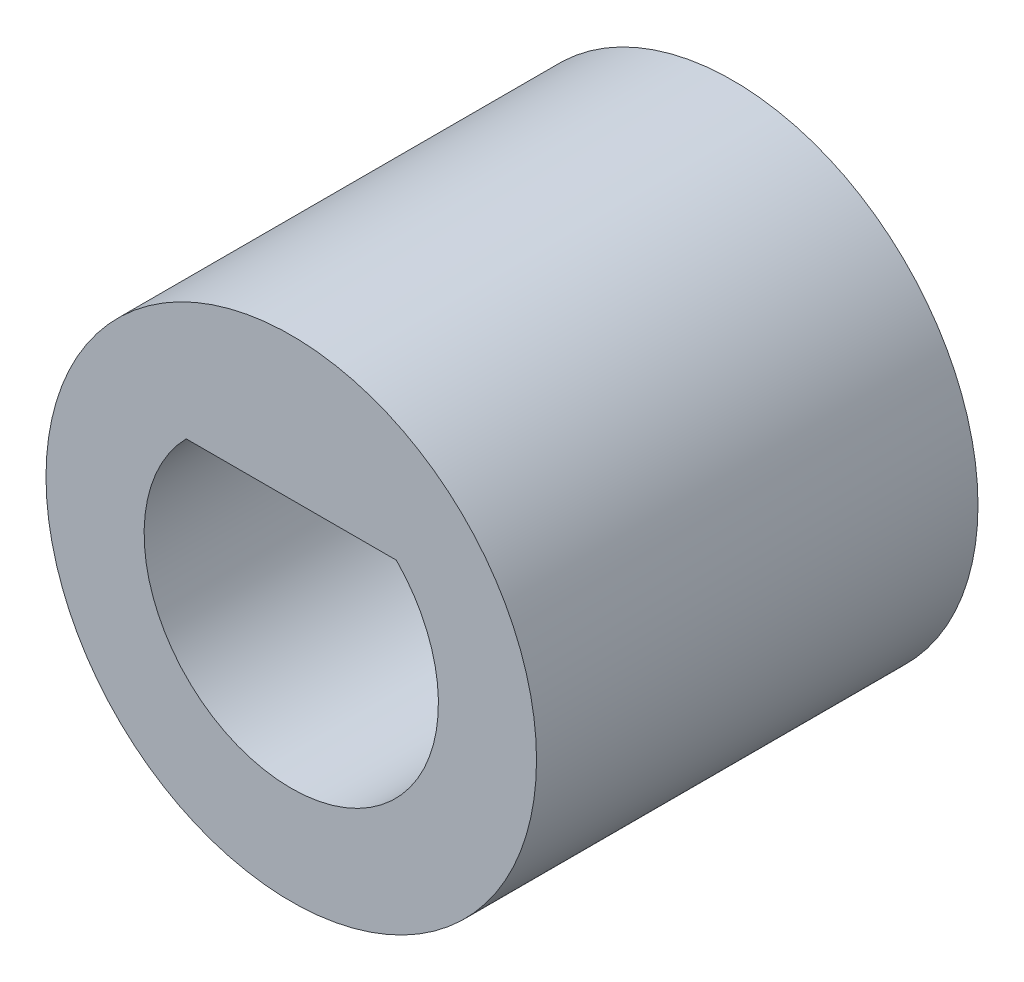
from build123d import *

# Parameters (mm, degrees)
ESQUISSE1_R        = 5
BOSS_EXTRU_1_DEPTH = 9


with BuildPart() as part:
    # Esquisse1 → Boss.-Extru.1 (new body)
    with BuildSketch(Plane.XY):
        Circle(ESQUISSE1_R)
        with BuildLine():
            Line((-2.142428529, 2.1), (2.142428529, 2.1))
            ThreePointArc((2.142428529, 2.1), (0, -3), (-2.142428529, 2.1))
        make_face(mode=Mode.SUBTRACT)
    extrude(amount=BOSS_EXTRU_1_DEPTH)


solid = part.part
